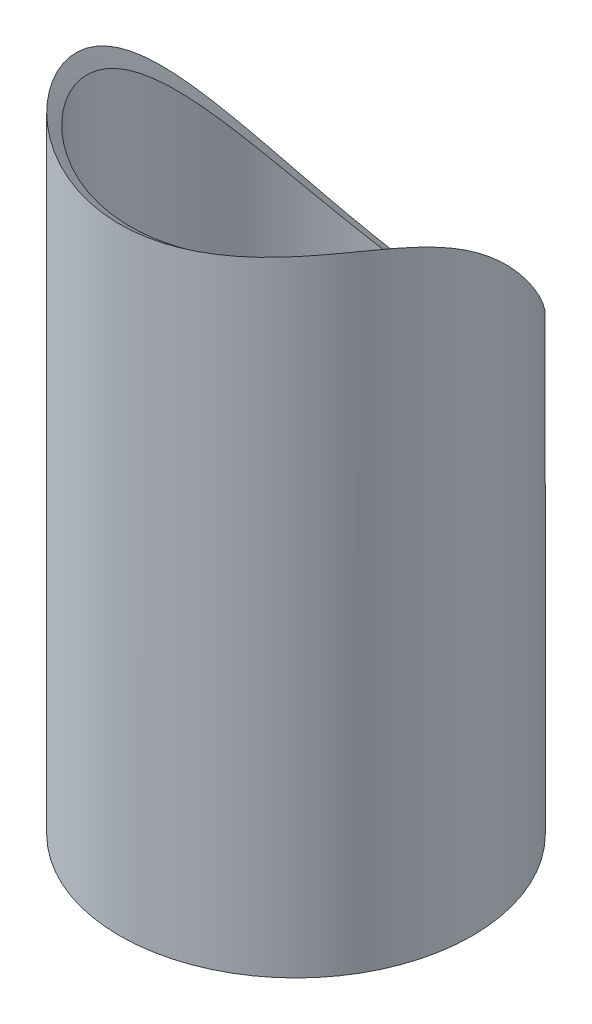
from build123d import *

# Parameters (mm, degrees)
EXTRUDE_1_OUTLINE_R      = 50
EXTRUDE_1_OUTLINE_R_2    = 47
EXTRUDE_1_DEPTH          = 200
CUT_EXTRUDE_1_DEPTH      = 213.132034356
CUT_EXTRUDE_1_DEPTH_BACK = 213.132034356
SKETCH_2_R               = 65.5


# Read off the part's stored shape, not the designer's step: Вытянуть-Тонкостенный1
with BuildPart() as part:
    # Вытянуть-Тонкостенный1 outline → Вытянуть-Тонкостенный1 (new body)
    with BuildSketch(Plane(origin=(0, 0, 0), x_dir=(1, 0, 0), z_dir=(0, 1, 0))):
        Circle(EXTRUDE_1_OUTLINE_R)
        Circle(EXTRUDE_1_OUTLINE_R_2, mode=Mode.SUBTRACT)
    extrude(amount=EXTRUDE_1_DEPTH)

    # Эскиз2 → Вырез-Вытянуть1 (cut, two sides: drawn at the far end of the back side and taken through both)
    with BuildSketch(Plane(origin=(0, 0, 0), x_dir=(1, 0, 0), z_dir=(0, -0.5735764363510444, -0.819152044288993)).offset(-CUT_EXTRUDE_1_DEPTH_BACK)):
        with Locations((0, -180)):
            Circle(SKETCH_2_R)
    extrude(amount=CUT_EXTRUDE_1_DEPTH + CUT_EXTRUDE_1_DEPTH_BACK, mode=Mode.SUBTRACT)


solid = part.part
